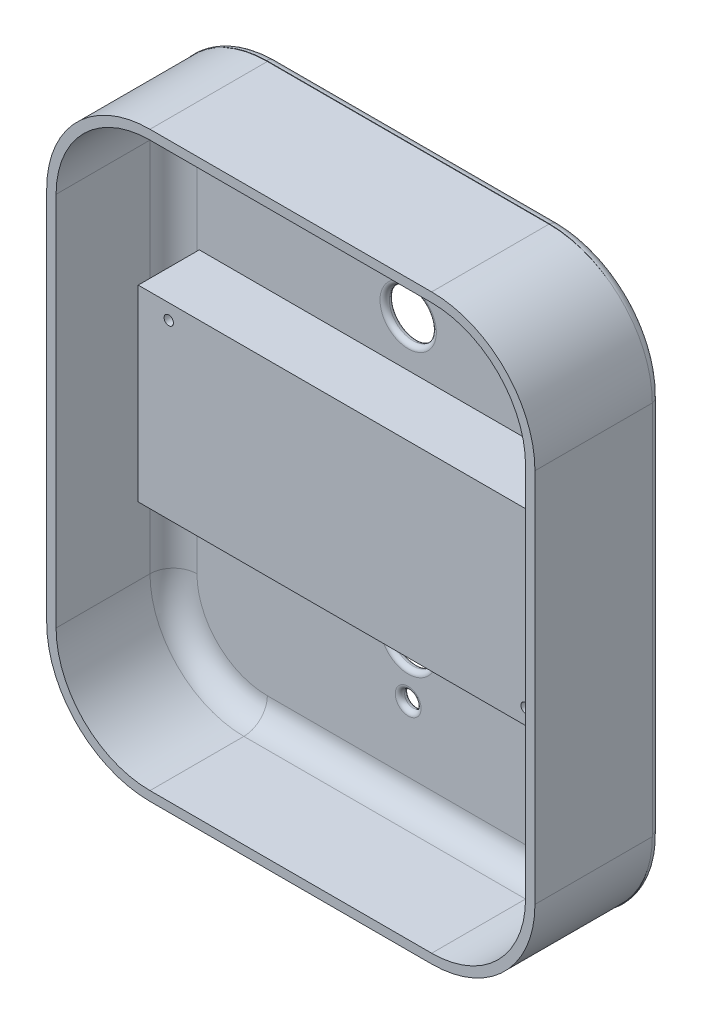
from build123d import *

# Parameters (mm, degrees)
BOSS_EXTRUDE7_DEPTH  = 25
CASE_BOTTOM_R        = 1.75
CASE_BOTTOM_R_2      = 5
BOSS_EXTRUDE9_DEPTH  = 2
FILLET1_R            = 5
FILLET2_R            = 2
FILLET3_R            = 1
SONOFF_W             = 89
SONOFF_H             = 40
SONOFF_R             = 1
BOSS_EXTRUDE10_DEPTH = 13


# Some blends are built 0.0001 mm under size
with BuildPart() as part:
    # Case Sides → Boss-Extrude7 (new body)
    with BuildSketch(Plane.XY):
        with BuildLine():
            Line((-30, 62), (30, 62))
            ThreePointArc((30, 62), (45.556349186, 55.556349186), (52, 40))
            Line((52, 40), (52, -40))
            ThreePointArc((52, -40), (45.556349186, -55.556349186), (30, -62))
            Line((30, -62), (-30, -62))
            ThreePointArc((-30, -62), (-45.556349186, -55.556349186), (-52, -40))
            Line((-52, -40), (-52, 40))
            ThreePointArc((-52, 40), (-45.556349186, 55.556349186), (-30, 62))
        make_face()
        with BuildLine():
            Line((-30, 60), (30, 60))
            ThreePointArc((30, 60), (44.142135624, 54.142135624), (50, 40))
            Line((50, 40), (50, -40))
            ThreePointArc((50, -40), (44.142135624, -54.142135624), (30, -60))
            Line((30, -60), (-30, -60))
            ThreePointArc((-30, -60), (-44.142135624, -54.142135624), (-50, -40))
            Line((-50, -40), (-50, 40))
            ThreePointArc((-50, 40), (-44.142135624, 54.142135624), (-30, 60))
        make_face(mode=Mode.SUBTRACT)
    extrude(amount=BOSS_EXTRUDE7_DEPTH)

    # Case Bottom → Boss-Extrude9 (add)
    with BuildSketch(Plane.XY):
        with BuildLine():
            Line((-30.166381545, 62.101220113), (30.166381545, 62.101220113))
            ThreePointArc((30.166381545, 62.101220113), (45.607883681, 55.461776572), (51.813647258, 39.840934815))
            Line((51.813647258, 39.840934815), (51.813647258, -39.840934815))
            ThreePointArc((51.813647258, -39.840934815), (45.787828122, -55.499068587), (30.267855704, -61.872302115))
            Line((30.267855704, -61.872302115), (-30.267855704, -61.872302115))
            ThreePointArc((-30.267855704, -61.872302115), (-45.835002173, -55.567695757), (-52.186199447, -40.019499601))
            Line((-52.186199447, -40.019499601), (-52.186199447, 40.019499601))
            ThreePointArc((-52.186199447, 40.019499601), (-45.654372223, 55.52588799), (-30.166381545, 62.101220113))
        make_face()
        with Locations((0, 41)):
            Circle(CASE_BOTTOM_R, mode=Mode.SUBTRACT)
        with Locations((0, -41)):
            Circle(CASE_BOTTOM_R, mode=Mode.SUBTRACT)
        with Locations((0, 30)):
            Circle(CASE_BOTTOM_R_2, mode=Mode.SUBTRACT)
        with Locations((0, -30)):
            Circle(CASE_BOTTOM_R_2, mode=Mode.SUBTRACT)
    extrude(amount=-BOSS_EXTRUDE9_DEPTH)

    # Fillet1
    fillet1_edges = [part.edges().sort_by_distance(p)[0] for p in [
        (44.142135624, 54.142135624, 0),
        (0, 60, 0),
        (-44.142135624, 54.142135624, 0),
        (-50, 0, 0),
        (-44.142135624, -54.142135624, 0),
        (0, -60, 0),
        (44.142135624, -54.142135624, 0),
        (50, 0, 0),
    ]]
    fillet(fillet1_edges, radius=FILLET1_R)

    # Fillet2
    # the kernel refuses this fillet: 2 mm, written as the material it adds along each edge
    with BuildSketch(Plane(origin=(51.813647258, 39.840934815, 0.036995851), x_dir=(0.014804575706989804, 0.9998904062636744, 0), z_dir=(0, 0, -1))) as fillet2_piece_1:
        with BuildLine():
            CenterArc((0.014812433, 1.999999896), FILLET2_R, 269.151729306, 0.829764856)
            Line((-0.014796719, 0.000219083), (0, 0))
            ThreePointArc((0, 0), (0.007083229, 1.144e-06), (0.014166457, 0))
        make_face()
    extrude(amount=2.036995851)
    with BuildSketch(Plane(origin=(51.813647258, -39.840934815, 0.096592655), x_dir=(0, 1, 0), z_dir=(0, 0, -1))) as fillet2_piece_2:
        with BuildLine():
            CenterArc((0.038637062, 2), FILLET2_R, 267.835326297, 2.164673703)
            ThreePointArc((-0.03690633, 0.00142721), (-0.018452854, 0.000721643), (0, 0))
            Line((0, 0), (0.038637062, 0))
        make_face()
    extrude(amount=2.096592655)
    with BuildSketch(Plane(origin=(30.267855704, -61.872302115, 0.042125301), x_dir=(0.9998579024887219, -0.016857485899548712, 0), z_dir=(0, 0, -1))) as fillet2_piece_3:
        with BuildLine():
            CenterArc((0.016867246, 1.999999856), FILLET2_R, 269.034091453, 0.944139309)
            Line((-0.016847726, 0.000284051), (0, 0))
            ThreePointArc((0, 0), (0.008053678, 1.53e-06), (0.016107356, 0))
        make_face()
    extrude(amount=2.042125301)
    with BuildSketch(Plane(origin=(-30.267855704, -61.872302115, 0.034939961), x_dir=(-0.9999022450245147, -0.013982145576956704, 0), z_dir=(0, 0, -1))) as fillet2_piece_4:
        with BuildLine():
            CenterArc((0.013989673, -1.999999904), FILLET2_R, 90.017724864, 0.783419172)
            Line((-0.013974618, -0.000195414), (0, 0))
            ThreePointArc((0, 0), (0.006685479, -1.034e-06), (0.013370958, 0))
        make_face()
    extrude(amount=2.034939961)
    with BuildSketch(Plane(origin=(-52.186199447, -40.019499601, 0), x_dir=(0, 1, 0), z_dir=(0, 0, -1))) as fillet2_piece_5:
        with BuildLine():
            CenterArc((0.011047407, -2), FILLET2_R, 90, 0.619262575)
            ThreePointArc((-0.010568514, -0.000116815), (-0.00528425, -5.9054e-05), (0, 0))
            Line((0, 0), (0.011047407, 0))
        make_face()
    extrude(amount=2)
    # the kernel refuses this fillet: 2 mm, written as the material it takes off along each edge
    with BuildSketch(Plane(origin=(-52.186199447, 40.019499601, 0.035818212), x_dir=(0, -1, 0), z_dir=(0, 0, -1))) as fillet2_2_piece_1:
        with BuildLine():
            CenterArc((0.013672232, -2), FILLET2_R, 90, 0.802114876)
            ThreePointArc((-0.014325944, -0.000195984), (-0.007162988, -9.6846e-05), (0, 0))
            Line((0, 0), (0.013672232, 0))
        make_face()
    extrude(amount=2.071636423, mode=Mode.SUBTRACT)
    with BuildSketch(Plane(origin=(-30.166381545, 62.101220113, 0.043345147), x_dir=(1, 0, 0), z_dir=(0, 0, -1))) as fillet2_2_piece_2:
        with BuildLine():
            CenterArc((0.016545352, 2), FILLET2_R, 269.029333404, 0.970666596)
            ThreePointArc((-0.017335683, 0.000287002), (-0.008667869, 0.000141822), (0, 0))
            Line((0, 0), (0.016545352, 0))
        make_face()
    extrude(amount=2.086690294, mode=Mode.SUBTRACT)
    with BuildSketch(Plane(origin=(30.166381545, 62.101220113, 0.034352007), x_dir=(0.9999141102581969, -0.013106185812745422, 0), z_dir=(0, 0, -1))) as fillet2_2_piece_3:
        with BuildLine():
            CenterArc((0.013114237, 1.999999902), FILLET2_R, 269.249049368, 0.768900433)
            Line((-0.013098135, 0.000171681), (0, 0))
            ThreePointArc((0, 0), (0.006870401, -1.076e-06), (0.013740803, 0))
        make_face()
    extrude(amount=2.068704014, mode=Mode.SUBTRACT)
    # the kernel refuses this fillet: 2 mm, written as the material it takes off along each edge
    with BuildSketch(Plane(origin=(-29.804526261, 39.720474564, -2), x_dir=(-0.9999020079624725, 0.013999088278010021, 0), z_dir=(-0.013999088278010021, -0.9999020079624725, 0))) as fillet2_3_piece_1:
        with BuildLine():
            CenterArc((22.383670624 - FILLET2_R, -FILLET2_R), FILLET2_R, 0, 90)
            Line((22.383670624, -FILLET2_R), (22.383670624, 0))
            Line((22.383670624, 0), (22.383670624 - FILLET2_R, 0))
        make_face()
    revolve(axis=Axis((-29.804526261, 39.720474564, -2), (0, 0, -1)), revolution_arc=88.227218528, mode=Mode.SUBTRACT)
    with BuildSketch(Plane(origin=(-30.149836193, 62.101220113, -2), x_dir=(0, -1, 0), z_dir=(1, 0, 0))) as fillet2_3_piece_2:
        with BuildLine():
            CenterArc((FILLET2_R, -FILLET2_R), FILLET2_R, 90, 90)
            Line((0, -FILLET2_R), (0, 0))
            Line((0, 0), (FILLET2_R, 0))
        make_face()
    extrude(amount=60.303118478, mode=Mode.SUBTRACT)
    with BuildSketch(Plane(origin=(29.885828413, 40.172686456, -2), x_dir=(0.013419441370281596, 0.9999099552426256, 0), z_dir=(-0.9999099552426256, 0.013419441370281596, 0))) as fillet2_3_piece_3:
        with BuildLine():
            CenterArc((21.930328279 - FILLET2_R, -FILLET2_R), FILLET2_R, 0, 90)
            Line((21.930328279, -FILLET2_R), (21.930328279, 0))
            Line((21.930328279, 0), (21.930328279 - FILLET2_R, 0))
        make_face()
    revolve(axis=Axis((29.885828413, 40.172686456, -2), (0, 0, -1)), revolution_arc=90.060864423, mode=Mode.SUBTRACT)
    with BuildSketch(Plane(origin=(51.813647258, 39.826136474, -2), x_dir=(-1, 0, 0), z_dir=(0, -1, 0))) as fillet2_3_piece_4:
        with BuildLine():
            CenterArc((FILLET2_R, -FILLET2_R), FILLET2_R, 90, 90)
            Line((0, -FILLET2_R), (0, 0))
            Line((0, 0), (FILLET2_R, 0))
        make_face()
    extrude(amount=79.628434227, mode=Mode.SUBTRACT)
    with BuildSketch(Plane(origin=(30.63323575, -40.678486464, -2), x_dir=(0.999286394870838, 0.03777169609699212, 0), z_dir=(-0.03777169609699212, 0.999286394870838, 0))) as fillet2_3_piece_5:
        with BuildLine():
            CenterArc((21.196964981 - FILLET2_R, -FILLET2_R), FILLET2_R, 0, 90)
            Line((21.196964981, -FILLET2_R), (21.196964981, 0))
            Line((21.196964981, 0), (21.196964981 - FILLET2_R, 0))
        make_face()
    revolve(axis=Axis((30.63323575, -40.678486464, -2), (0, 0, -1)), revolution_arc=93.108813012, mode=Mode.SUBTRACT)
    with BuildSketch(Plane(origin=(30.251005584, -61.872302115, -2), x_dir=(0, 1, 0), z_dir=(-1, 0, 0))) as fillet2_3_piece_6:
        with BuildLine():
            CenterArc((FILLET2_R, -FILLET2_R), FILLET2_R, 90, 90)
            Line((0, -FILLET2_R), (0, 0))
            Line((0, 0), (FILLET2_R, 0))
        make_face()
    extrude(amount=60.504885303, mode=Mode.SUBTRACT)
    with BuildSketch(Plane(origin=(-30.576706868, -40.263637561, -2), x_dir=(0.013672817925882458, -0.9999065226559758, 0), z_dir=(0.9999065226559758, 0.013672817925882458, 0))) as fillet2_3_piece_7:
        with BuildLine():
            CenterArc((21.610871636 - FILLET2_R, -FILLET2_R), FILLET2_R, 0, 90)
            Line((21.610871636, -FILLET2_R), (21.610871636, 0))
            Line((21.610871636, 0), (21.610871636 - FILLET2_R, 0))
        make_face()
    revolve(axis=Axis((-30.576706868, -40.263637561, -2), (0, 0, -1)), revolution_arc=91.402681747, mode=Mode.SUBTRACT)
    with BuildSketch(Plane(origin=(-52.186199447, -40.008452194, -2), x_dir=(1, 0, 0), z_dir=(0, 1, 0))) as fillet2_3_piece_8:
        with BuildLine():
            CenterArc((FILLET2_R, -FILLET2_R), FILLET2_R, 90, 90)
            Line((0, -FILLET2_R), (0, 0))
            Line((0, 0), (FILLET2_R, 0))
        make_face()
    extrude(amount=80.014279563, mode=Mode.SUBTRACT)
    with BuildSketch(Plane(origin=(-54.186199447, -40.008452194, -2), x_dir=(1, 0, 0), z_dir=(0, 1, 0))) as fillet2_3_piece_9:
        with BuildLine():
            CenterArc((2 + FILLET2_R, -FILLET2_R), FILLET2_R, 90, 90)
            Line((2, -FILLET2_R), (2, 0))
            Line((2, 0), (2 + FILLET2_R, 0))
        make_face()
    revolve(axis=Axis((-54.186199447, -40.008452194, -2), (0, 0, -1)), revolution_arc=0.619262575, mode=Mode.SUBTRACT)
    with BuildSketch(Plane(origin=(-50.186199447, 40.005827368, -2), x_dir=(-0.9999020079624727, 0.013999088277994795, 0), z_dir=(0.013999088277994795, 0.9999020079624727, 0))) as fillet2_3_piece_10:
        with BuildLine():
            CenterArc((2 - FILLET2_R, FILLET2_R), FILLET2_R, 270, 90)
            Line((2, FILLET2_R), (2, 0))
            Line((2, 0), (2 - FILLET2_R, 0))
        make_face()
    revolve(axis=Axis((-50.186199447, 40.005827368, -2), (0, 0, 1)), revolution_arc=0.802114876, mode=Mode.SUBTRACT)
    with BuildSketch(Plane(origin=(-30.253879719, -63.872302115, -2), x_dir=(-0.013672817925883145, 0.999906522655976, 0), z_dir=(-0.999906522655976, -0.013672817925883145, 0))) as fillet2_3_piece_11:
        with BuildLine():
            CenterArc((2 + FILLET2_R, -FILLET2_R), FILLET2_R, 90, 90)
            Line((2, -FILLET2_R), (2, 0))
            Line((2, 0), (2 + FILLET2_R, 0))
        make_face()
    revolve(axis=Axis((-30.253879719, -63.872302115, -2), (0, 0, -1)), revolution_arc=0.783419172, mode=Mode.SUBTRACT)
    with BuildSketch(Plane(origin=(30.251005584, -63.872302115, -2), x_dir=(0.016477593803021027, 0.9998642352351956, 0), z_dir=(0.9998642352351956, -0.016477593803021027, 0))) as fillet2_3_piece_12:
        with BuildLine():
            CenterArc((2 + FILLET2_R, FILLET2_R), FILLET2_R, 180, 90)
            Line((2, FILLET2_R), (2, 0))
            Line((2, 0), (2 + FILLET2_R, 0))
        make_face()
    revolve(axis=Axis((30.251005584, -63.872302115, -2), (0, 0, 1)), revolution_arc=0.944139309, mode=Mode.SUBTRACT)
    with BuildSketch(Plane(origin=(53.813647258, -39.802297753, -2), x_dir=(-1, 0, 0), z_dir=(0, 1, 0))) as fillet2_3_piece_13:
        with BuildLine():
            CenterArc((2 + FILLET2_R, FILLET2_R), FILLET2_R, 180, 90)
            Line((2, FILLET2_R), (2, 0))
            Line((2, 0), (2 + FILLET2_R, 0))
        make_face()
    revolve(axis=Axis((53.813647258, -39.802297753, -2), (0, 0, 1)), revolution_arc=2.164673703, mode=Mode.SUBTRACT)
    with BuildSketch(Plane(origin=(53.813647258, 39.826136474, -2), x_dir=(-0.9998951358062248, 0.014481622528268918, 0), z_dir=(0.014481622528268918, 0.9998951358062248, 0))) as fillet2_3_piece_14:
        with BuildLine():
            CenterArc((2 + FILLET2_R, FILLET2_R), FILLET2_R, 180, 90)
            Line((2, FILLET2_R), (2, 0))
            Line((2, 0), (2 + FILLET2_R, 0))
        make_face()
    revolve(axis=Axis((53.813647258, 39.826136474, -2), (0, 0, 1)), revolution_arc=0.829764856, mode=Mode.SUBTRACT)
    with BuildSketch(Plane(origin=(30.153282285, 60.101220113, -2), x_dir=(0.013419441370290391, 0.9999099552426255, 0), z_dir=(0.9999099552426255, -0.013419441370290391, 0))) as fillet2_3_piece_15:
        with BuildLine():
            CenterArc((2 - FILLET2_R, FILLET2_R), FILLET2_R, 270, 90)
            Line((2, FILLET2_R), (2, 0))
            Line((2, 0), (2 - FILLET2_R, 0))
        make_face()
    revolve(axis=Axis((30.153282285, 60.101220113, -2), (0, 0, 1)), revolution_arc=0.768900433, mode=Mode.SUBTRACT)
    with BuildSketch(Plane(origin=(-30.149836193, 60.101220113, -2), x_dir=(0, 1, 0), z_dir=(1, 0, 0))) as fillet2_3_piece_16:
        with BuildLine():
            CenterArc((2 - FILLET2_R, FILLET2_R), FILLET2_R, 270, 90)
            Line((2, FILLET2_R), (2, 0))
            Line((2, 0), (2 - FILLET2_R, 0))
        make_face()
    revolve(axis=Axis((-30.149836193, 60.101220113, -2), (0, 0, 1)), revolution_arc=0.970666596, mode=Mode.SUBTRACT)

    # Fillet3
    fillet3_edges = [part.edges().sort_by_distance(p)[0] for p in [
        (-5, -30, -2),
        (-5, 30, -2),
        (-1.75, -41, -2),
        (-1.75, 41, -2),
        (-1.75, 41, 0),
        (-1.75, -41, 0),
        (-5, 30, 0),
        (-5, -30, 0),
    ]]
    fillet(fillet3_edges, radius=FILLET3_R - 0.0001)  # a hair under: the kernel refuses the full size

    # Sonoff → Boss-Extrude10 (add)
    with BuildSketch(Plane.XY):
        Rectangle(SONOFF_W, SONOFF_H)
        with Locations((-38, 16.75)):
            Circle(SONOFF_R, mode=Mode.SUBTRACT)
        with Locations((38, -16.75)):
            Circle(SONOFF_R, mode=Mode.SUBTRACT)
    extrude(amount=BOSS_EXTRUDE10_DEPTH)


solid = part.part
